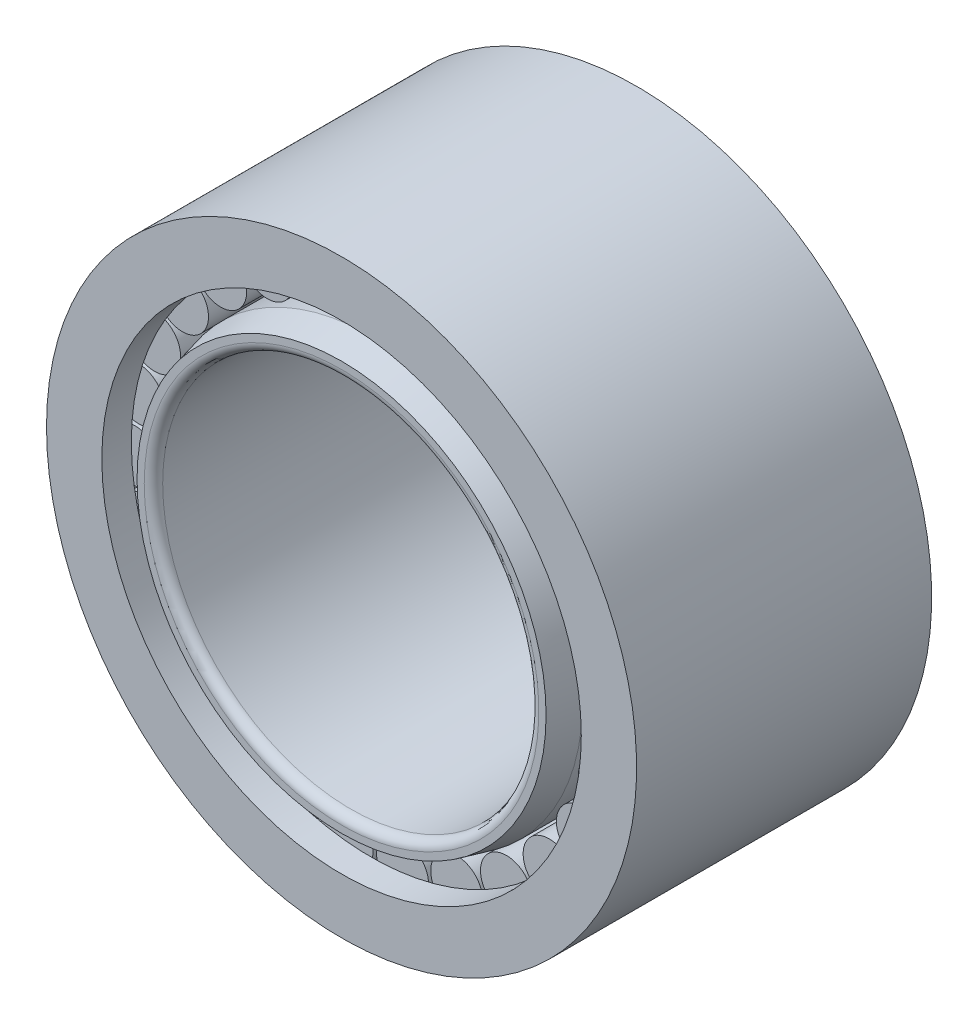
from build123d import *

# Parameters (mm, degrees)
SKETCH3_W         = 12.4
SKETCH3_H         = 1.41
CIRPATTERN1_COUNT = 27


with BuildPart() as part:
    # Sketch1 → Revolve1 (revolve)
    with BuildSketch(Plane(origin=(0, 0, 0), x_dir=(0, 0, -1), z_dir=(1, 0, 0))):
        Polygon((-8, 13), (-8, 16), (8, 16), (8, 13), (6.4, 13), (6.4, 14.53), (-6.4, 14.53), (-6.4, 13), align=None)
    revolve(axis=Axis((0, 0, -22), (0, 0, 1)))


with BuildPart() as body_2:
    # Sketch2 → Revolve2 (revolve)
    with BuildSketch(Plane(origin=(0, 0, 0), x_dir=(0, 0, -1), z_dir=(1, 0, 0))):
        with BuildLine():
            Line((-7.5, 10.2), (7.5, 10.2))
            ThreePointArc((7.5, 10.2), (7.853553391, 10.346446609), (8, 10.7))
            Line((8, 10.7), (8, 11.09))
            Line((8, 11.09), (6.4, 11.47))
            Line((6.4, 11.47), (-6.4, 11.47))
            Line((-6.4, 11.47), (-8, 11.09))
            Line((-8, 11.09), (-8, 10.7))
            ThreePointArc((-8, 10.7), (-7.853553391, 10.346446609), (-7.5, 10.2))
        make_face()
    revolve(axis=Axis((0, 0, -22), (0, 0, 1)))


with BuildPart() as body_3:
    # Sketch3 → Revolve3 (revolve)
    with BuildSketch(Plane(origin=(0, 0, 0), x_dir=(0, 0, -1), z_dir=(1, 0, 0))):
        with Locations((0, 13.705)):
            Rectangle(SKETCH3_W, SKETCH3_H)
    revolve(axis=Axis((0, 13, -6.2), (0, 0, 1)))


with BuildPart() as cirpattern1_1:
    # CirPattern1: pattern copy
    add(body_3.part.rotate(Axis((0, 0, -22), (0, 0, -1)), 1 * 360 / CIRPATTERN1_COUNT))


with BuildPart() as cirpattern1_2:
    # CirPattern1: pattern copy
    add(body_3.part.rotate(Axis((0, 0, -22), (0, 0, -1)), 2 * 360 / CIRPATTERN1_COUNT))


with BuildPart() as cirpattern1_3:
    # CirPattern1: pattern copy
    add(body_3.part.rotate(Axis((0, 0, -22), (0, 0, -1)), 3 * 360 / CIRPATTERN1_COUNT))


with BuildPart() as cirpattern1_4:
    # CirPattern1: pattern copy
    add(body_3.part.rotate(Axis((0, 0, -22), (0, 0, -1)), 4 * 360 / CIRPATTERN1_COUNT))


with BuildPart() as cirpattern1_5:
    # CirPattern1: pattern copy
    add(body_3.part.rotate(Axis((0, 0, -22), (0, 0, -1)), 5 * 360 / CIRPATTERN1_COUNT))


with BuildPart() as cirpattern1_6:
    # CirPattern1: pattern copy
    add(body_3.part.rotate(Axis((0, 0, -22), (0, 0, -1)), 6 * 360 / CIRPATTERN1_COUNT))


with BuildPart() as cirpattern1_7:
    # CirPattern1: pattern copy
    add(body_3.part.rotate(Axis((0, 0, -22), (0, 0, -1)), 7 * 360 / CIRPATTERN1_COUNT))


with BuildPart() as cirpattern1_8:
    # CirPattern1: pattern copy
    add(body_3.part.rotate(Axis((0, 0, -22), (0, 0, -1)), 8 * 360 / CIRPATTERN1_COUNT))


with BuildPart() as cirpattern1_9:
    # CirPattern1: pattern copy
    add(body_3.part.rotate(Axis((0, 0, -22), (0, 0, -1)), 9 * 360 / CIRPATTERN1_COUNT))


with BuildPart() as cirpattern1_10:
    # CirPattern1: pattern copy
    add(body_3.part.rotate(Axis((0, 0, -22), (0, 0, -1)), 10 * 360 / CIRPATTERN1_COUNT))


with BuildPart() as cirpattern1_11:
    # CirPattern1: pattern copy
    add(body_3.part.rotate(Axis((0, 0, -22), (0, 0, -1)), 11 * 360 / CIRPATTERN1_COUNT))


with BuildPart() as cirpattern1_12:
    # CirPattern1: pattern copy
    add(body_3.part.rotate(Axis((0, 0, -22), (0, 0, -1)), 12 * 360 / CIRPATTERN1_COUNT))


with BuildPart() as cirpattern1_13:
    # CirPattern1: pattern copy
    add(body_3.part.rotate(Axis((0, 0, -22), (0, 0, -1)), 13 * 360 / CIRPATTERN1_COUNT))


with BuildPart() as cirpattern1_14:
    # CirPattern1: pattern copy
    add(body_3.part.rotate(Axis((0, 0, -22), (0, 0, -1)), 14 * 360 / CIRPATTERN1_COUNT))


with BuildPart() as cirpattern1_15:
    # CirPattern1: pattern copy
    add(body_3.part.rotate(Axis((0, 0, -22), (0, 0, -1)), 15 * 360 / CIRPATTERN1_COUNT))


with BuildPart() as cirpattern1_16:
    # CirPattern1: pattern copy
    add(body_3.part.rotate(Axis((0, 0, -22), (0, 0, -1)), 16 * 360 / CIRPATTERN1_COUNT))


with BuildPart() as cirpattern1_17:
    # CirPattern1: pattern copy
    add(body_3.part.rotate(Axis((0, 0, -22), (0, 0, -1)), 17 * 360 / CIRPATTERN1_COUNT))


with BuildPart() as cirpattern1_18:
    # CirPattern1: pattern copy
    add(body_3.part.rotate(Axis((0, 0, -22), (0, 0, -1)), 18 * 360 / CIRPATTERN1_COUNT))


with BuildPart() as cirpattern1_19:
    # CirPattern1: pattern copy
    add(body_3.part.rotate(Axis((0, 0, -22), (0, 0, -1)), 19 * 360 / CIRPATTERN1_COUNT))


with BuildPart() as cirpattern1_20:
    # CirPattern1: pattern copy
    add(body_3.part.rotate(Axis((0, 0, -22), (0, 0, -1)), 20 * 360 / CIRPATTERN1_COUNT))


with BuildPart() as cirpattern1_21:
    # CirPattern1: pattern copy
    add(body_3.part.rotate(Axis((0, 0, -22), (0, 0, -1)), 21 * 360 / CIRPATTERN1_COUNT))


with BuildPart() as cirpattern1_22:
    # CirPattern1: pattern copy
    add(body_3.part.rotate(Axis((0, 0, -22), (0, 0, -1)), 22 * 360 / CIRPATTERN1_COUNT))


with BuildPart() as cirpattern1_23:
    # CirPattern1: pattern copy
    add(body_3.part.rotate(Axis((0, 0, -22), (0, 0, -1)), 23 * 360 / CIRPATTERN1_COUNT))


with BuildPart() as cirpattern1_24:
    # CirPattern1: pattern copy
    add(body_3.part.rotate(Axis((0, 0, -22), (0, 0, -1)), 24 * 360 / CIRPATTERN1_COUNT))


with BuildPart() as cirpattern1_25:
    # CirPattern1: pattern copy
    add(body_3.part.rotate(Axis((0, 0, -22), (0, 0, -1)), 25 * 360 / CIRPATTERN1_COUNT))


with BuildPart() as cirpattern1_26:
    # CirPattern1: pattern copy
    add(body_3.part.rotate(Axis((0, 0, -22), (0, 0, -1)), 26 * 360 / CIRPATTERN1_COUNT))


solid = Compound([part.part, body_2.part, body_3.part, cirpattern1_1.part, cirpattern1_2.part, cirpattern1_3.part, cirpattern1_4.part, cirpattern1_5.part, cirpattern1_6.part, cirpattern1_7.part, cirpattern1_8.part, cirpattern1_9.part, cirpattern1_10.part, cirpattern1_11.part, cirpattern1_12.part, cirpattern1_13.part, cirpattern1_14.part, cirpattern1_15.part, cirpattern1_16.part, cirpattern1_17.part, cirpattern1_18.part, cirpattern1_19.part, cirpattern1_20.part, cirpattern1_21.part, cirpattern1_22.part, cirpattern1_23.part, cirpattern1_24.part, cirpattern1_25.part, cirpattern1_26.part])
